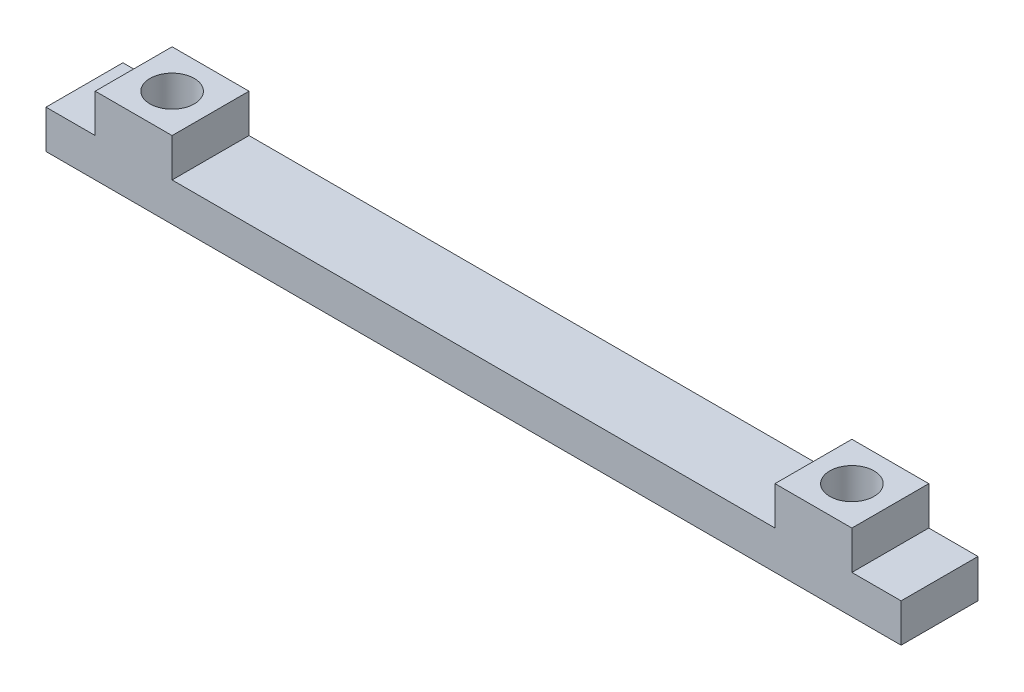
from build123d import *

# Parameters (mm, degrees)
BOSS_EXTRUDE1_DEPTH   = 6.35
F_6_CLEARANCE_HOLE1_D = 3.6576


with BuildPart() as part:
    # Sketch1 → Boss-Extrude1 (new body)
    with BuildSketch(Plane.XY):
        Polygon((0, 0), (70.612, 0), (70.612, 3.175), (66.548, 3.175), (66.548, 6.35), (60.198, 6.35), (60.198, 3.175), (10.414, 3.175), (10.414, 6.35), (4.064, 6.35), (4.064, 3.175), (0, 3.175), align=None)
    extrude(amount=BOSS_EXTRUDE1_DEPTH)

    # #6 Clearance Hole1 (through all)
    with Locations(Plane(origin=(7.239, 0, 3.175), x_dir=(0, 0, -1), z_dir=(0, -1, 0))):
        with Locations((0, 0), (0, 56.134)):
            Hole(F_6_CLEARANCE_HOLE1_D / 2)


solid = part.part
